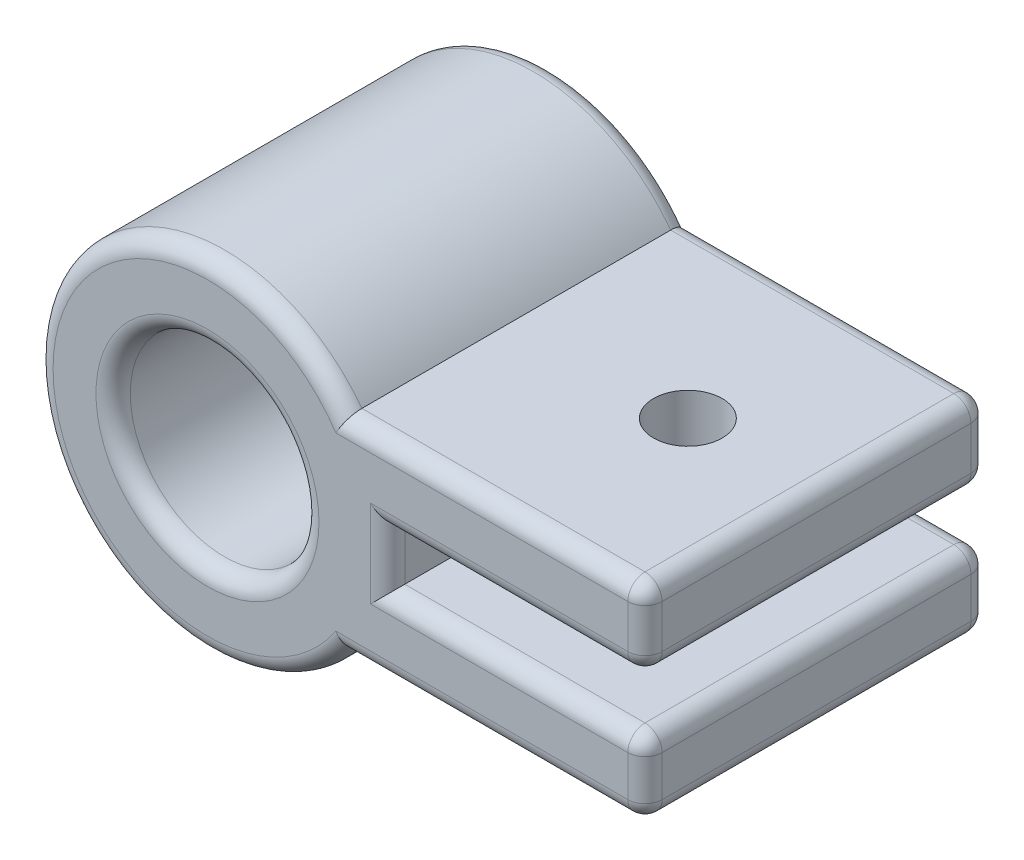
from build123d import *

# Parameters (mm, degrees)
SKETCH_1_R           = 10
SKETCH_1_R_2         = 5.5
EXTRUDE_1_DEPTH      = 20
EXTRUDE_2_DEPTH      = 6
EXTRUDE_2_DEPTH_BACK = 6
SKETCH_2_W           = 20
SKETCH_2_H           = 20
SKETCH_2_R           = 2
SKETCH_3_W           = 20
SKETCH_3_H           = 3.1
CUT_EXTRUDE_1_DEPTH  = 15
FILLET_1_R           = 1


with BuildPart() as part:
    # 草图1 → 凸台-拉伸1 (new body)
    with BuildSketch(Plane.XY):
        Circle(SKETCH_1_R)
        Circle(SKETCH_1_R_2, mode=Mode.SUBTRACT)
    extrude(amount=EXTRUDE_1_DEPTH)

    # 草图2 → 凸台-拉伸2 (add, two sides: drawn at the far end of the back side and taken through both)
    with BuildSketch(Plane(origin=(0, 0, 0), x_dir=(1, 0, 0), z_dir=(0, 1, 0)).offset(-EXTRUDE_2_DEPTH_BACK)):
        with Locations((15.5, -10)):
            Rectangle(SKETCH_2_W, SKETCH_2_H)
        with Locations((18, -10)):
            Circle(SKETCH_2_R, mode=Mode.SUBTRACT)
    extrude(amount=EXTRUDE_2_DEPTH + EXTRUDE_2_DEPTH_BACK)

    # 草图3 → 切除-拉伸1 (cut)
    with BuildSketch(Plane(origin=(25.5, 0, 0), x_dir=(0, 0, -1), z_dir=(1, 0, 0))):
        with Locations((-10, -0.077105761)):
            Rectangle(SKETCH_3_W, SKETCH_3_H)
    extrude(amount=-CUT_EXTRUDE_1_DEPTH, mode=Mode.SUBTRACT)

    # 圆角1
    fillet_1_edges = [part.edges().sort_by_distance(p)[0] for p in [
        (25.5, -6, 10),
        (25.5, -1.627105761, 10),
        (25.5, 6, 10),
        (25.5, 1.472894239, 10),
        (-5.5, 0, 0),
        (16.75, 6, 0),
        (-10, 0, 0),
        (16.75, -6, 0),
        (25.5, -3.81355288, 0),
        (18, -1.627105761, 0),
        (10.5, -0.077105761, 0),
        (18, 1.472894239, 0),
        (25.5, 3.73644712, 0),
        (-5.5, 0, 20),
        (10.5, -0.077105761, 20),
        (18, -1.627105761, 20),
        (25.5, -3.81355288, 20),
        (16.75, -6, 20),
        (-10, 0, 20),
        (16.75, 6, 20),
        (25.5, 3.73644712, 20),
        (18, 1.472894239, 20),
    ]]
    fillet(fillet_1_edges, radius=FILLET_1_R)


solid = part.part
